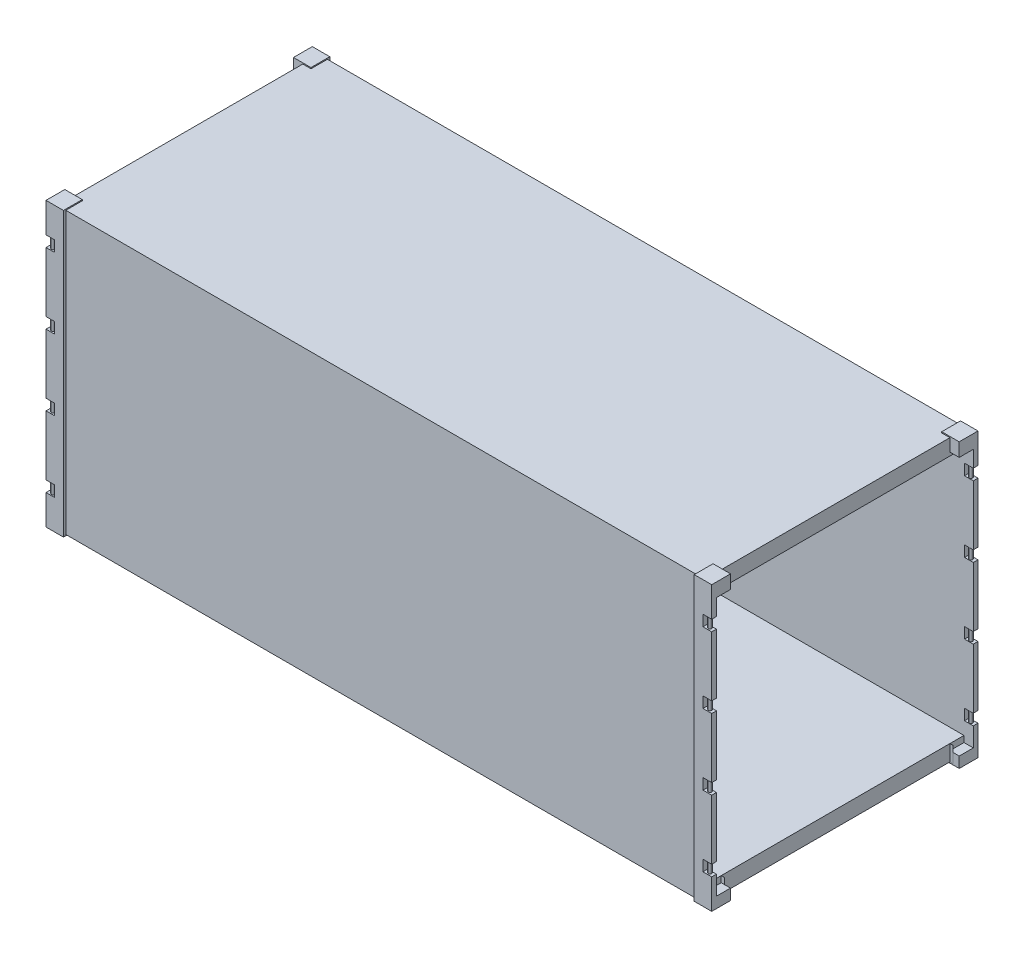
from build123d import *

# Parameters (mm, degrees)
SKETCH1_W             = 3048
SKETCH1_H             = 2581
BOSS_EXTRUDE1_DEPTH   = 1219.2
SKETCH2_W             = 2887.98
SKETCH2_H             = 21.59
CUT_EXTRUDE1_DEPTH    = 4680.285094969
SKETCH3_W             = 160
SKETCH3_H             = 172
BOSS_EXTRUDE2_DEPTH   = 10
CUT_EXTRUDE3_REACH    = 4602.631
SKETCH11_W            = 57.15
SKETCH11_H            = 1047.2
SKETCH18_W            = 3048
SKETCH18_H            = 1176.02
CUT_EXTRUDE10_DEPTH   = 2387.6
SKETCH20_W            = 85.09
SKETCH20_H            = 2094
CUT_EXTRUDE12_DEPTH   = 4685.808320519
SKETCH16_W            = 85.09
SKETCH16_H            = 128.82
CUT_EXTRUDE8_DEPTH    = 56.5
CUT_EXTRUDE19_REACH   = 4184.109
SKETCH29_W            = 80
SKETCH29_H            = 100
SKETCH36_W            = 2861.31
SKETCH36_H            = 1096.01
CUT_EXTRUDE25_DEPTH   = 132.79882
SKETCH44_W            = 15
SKETCH44_H            = 100
CUT_EXTRUDE26_DEPTH   = 10
LPATTERN1_COUNT       = 4
LPATTERN1_PITCH       = 647.75
SKETCH54_W            = 85.09
SKETCH54_H            = 129.02
BOSS_EXTRUDE4_DEPTH   = 76.2
SKETCH53_W            = 152.4
SKETCH53_H            = 107.696
BOSS_EXTRUDE3_DEPTH   = 1176.02
MIRROR2_START         = 10
MIRROR2_OUTLINE_R     = 15
MIRROR2_DEPTH         = 2571
MIRROR2_START_2       = 2543.1
MIRROR2_2_OUTLINE_R   = 15
MIRROR2_2_DEPTH       = 37.9
MIRROR2_3_OUTLINE_W   = 80
MIRROR2_3_OUTLINE_H   = 43.18
MIRROR2_3_OUTLINE_R   = 15
MIRROR2_3_DEPTH       = 145.5
MIRROR2_START_3       = 142.79882
MIRROR2_4_OUTLINE_W   = 2861.31
MIRROR2_4_OUTLINE_H   = 1096.01
MIRROR2_4_DEPTH       = 12.70118
MIRROR2_START_4       = 2435.404
MIRROR2_5_OUTLINE_W   = 80
MIRROR2_5_OUTLINE_H   = 43.18
MIRROR2_5_OUTLINE_R   = 15
MIRROR2_5_OUTLINE_W_2 = 152.4
MIRROR2_5_OUTLINE_H_2 = 1176.02
MIRROR2_5_DEPTH       = 107.696
MIRROR2_START_5       = 373.875
MIRROR2_6_OUTLINE_W   = 80
MIRROR2_6_OUTLINE_H   = 43.18
MIRROR2_6_OUTLINE_R   = 15
MIRROR2_6_DEPTH       = 547.75
MIRROR2_START_6       = 1021.625
MIRROR2_7_OUTLINE_W   = 80
MIRROR2_7_OUTLINE_H   = 43.18
MIRROR2_7_OUTLINE_R   = 15
MIRROR2_7_DEPTH       = 547.75
MIRROR2_START_7       = 1669.375
MIRROR2_8_OUTLINE_W   = 80
MIRROR2_8_OUTLINE_H   = 43.18
MIRROR2_8_OUTLINE_R   = 15
MIRROR2_8_DEPTH       = 547.75
MIRROR2_9_OUTLINE_W   = 160
MIRROR2_9_OUTLINE_H   = 172
MIRROR2_9_DEPTH       = 99
MIRROR2_START_8       = 2466.9
MIRROR2_10_OUTLINE_W  = 160.02
MIRROR2_10_OUTLINE_H  = 172.2
MIRROR2_10_DEPTH      = 124.1
MIRROR2_START_9       = 155.5
MIRROR2_11_OUTLINE_W  = 80
MIRROR2_11_OUTLINE_H  = 43.18
MIRROR2_11_OUTLINE_R  = 15
MIRROR2_11_DEPTH      = 118.375
MIRROR2_START_10      = 2317.125
MIRROR2_12_OUTLINE_W  = 80
MIRROR2_12_OUTLINE_H  = 43.18
MIRROR2_12_OUTLINE_R  = 15
MIRROR2_12_DEPTH      = 118.279
MIRROR1_START         = 10
MIRROR1_OUTLINE_R     = 15
MIRROR1_DEPTH         = 2571
MIRROR1_START_2       = 2543.1
MIRROR1_2_OUTLINE_R   = 15
MIRROR1_2_DEPTH       = 37.9
MIRROR1_3_OUTLINE_W   = 80
MIRROR1_3_OUTLINE_H   = 43.18
MIRROR1_3_OUTLINE_R   = 15
MIRROR1_3_DEPTH       = 145.5
MIRROR1_START_3       = 142.79882
MIRROR1_4_OUTLINE_W   = 2861.31
MIRROR1_4_OUTLINE_H   = 2192.02
MIRROR1_4_DEPTH       = 12.70118
MIRROR1_START_4       = 2435.404
MIRROR1_5_OUTLINE_W   = 152.4
MIRROR1_5_OUTLINE_H   = 2352.04
MIRROR1_5_OUTLINE_W_2 = 80
MIRROR1_5_OUTLINE_H_2 = 43.18
MIRROR1_5_OUTLINE_R   = 15
MIRROR1_5_DEPTH       = 107.696
MIRROR1_START_5       = 373.875
MIRROR1_6_OUTLINE_W   = 80
MIRROR1_6_OUTLINE_H   = 43.18
MIRROR1_6_OUTLINE_R   = 15
MIRROR1_6_DEPTH       = 547.75
MIRROR1_START_6       = 1021.625
MIRROR1_7_OUTLINE_W   = 80
MIRROR1_7_OUTLINE_H   = 43.18
MIRROR1_7_OUTLINE_R   = 15
MIRROR1_7_DEPTH       = 547.75
MIRROR1_START_7       = 1669.375
MIRROR1_8_OUTLINE_W   = 80
MIRROR1_8_OUTLINE_H   = 43.18
MIRROR1_8_OUTLINE_R   = 15
MIRROR1_8_DEPTH       = 547.75
MIRROR1_9_OUTLINE_W   = 160
MIRROR1_9_OUTLINE_H   = 172
MIRROR1_9_DEPTH       = 99
MIRROR1_START_8       = 2466.9
MIRROR1_10_OUTLINE_W  = 160.02
MIRROR1_10_OUTLINE_H  = 172.2
MIRROR1_10_DEPTH      = 124.1
MIRROR1_START_9       = 155.5
MIRROR1_11_OUTLINE_W  = 80
MIRROR1_11_OUTLINE_H  = 43.18
MIRROR1_11_OUTLINE_R  = 15
MIRROR1_11_DEPTH      = 118.375
MIRROR1_START_10      = 2317.125
MIRROR1_12_OUTLINE_W  = 80
MIRROR1_12_OUTLINE_H  = 43.18
MIRROR1_12_OUTLINE_R  = 15
MIRROR1_12_DEPTH      = 118.279


# Read off the part's stored shape, not the designer's step: Mirror2, Mirror1
with BuildPart() as part:
    # Sketch1 → Boss-Extrude1 (new body)
    with BuildSketch(Plane.XY.offset(2438)):
        with Locations((1524, 1300.5)):
            Rectangle(SKETCH1_W, SKETCH1_H)
    extrude(amount=-BOSS_EXTRUDE1_DEPTH)

    # Sketch2 → Cut-Extrude1 (cut, through all)
    with BuildSketch(Plane(origin=(0, 2591, 0), x_dir=(-1, 0, 0), z_dir=(0, 1, 0))):
        with Locations((-1604.01, 2427.205)):
            Rectangle(SKETCH2_W, SKETCH2_H)
    extrude(amount=-CUT_EXTRUDE1_DEPTH, mode=Mode.SUBTRACT)

    # Sketch3 → Boss-Extrude2 (add)
    with BuildSketch(Plane.XZ.offset(-10)):
        with Locations((80, 2352)):
            Rectangle(SKETCH3_W, SKETCH3_H)
    extrude(amount=BOSS_EXTRUDE2_DEPTH)

    # Sketch11 → Cut-Extrude3 (cut, up to next)
    with BuildSketch(Plane(origin=(0, 2435.5, 0), x_dir=(-1, 0, 0), z_dir=(0, 1, 0)), mode=Mode.PRIVATE) as cut_extrude3_sk1:
        with Locations((-28.575, 1742.4)):
            Rectangle(SKETCH11_W, SKETCH11_H)
    cut_extrude3_tool1 = extrude(cut_extrude3_sk1.sketch, amount=-CUT_EXTRUDE3_REACH, mode=Mode.PRIVATE) & part.part
    add(cut_extrude3_tool1.solids().sort_by_distance((28.575, 2435.5, 1742.4))[0], mode=Mode.SUBTRACT)

    # Sketch18 → Cut-Extrude10 (cut)
    with BuildSketch(Plane.XZ.offset(-155.5)):
        with Locations((1524, 1806.81)):
            Rectangle(SKETCH18_W, SKETCH18_H)
    extrude(amount=-CUT_EXTRUDE10_DEPTH, mode=Mode.SUBTRACT)

    # Sketch20 → Cut-Extrude12 (cut, through all)
    with BuildSketch(Plane(origin=(0, 2591, 0), x_dir=(-1, 0, 0), z_dir=(0, 1, 0))):
        with Locations((-42.545, 1218.8)):
            Rectangle(SKETCH20_W, SKETCH20_H)
    extrude(amount=-CUT_EXTRUDE12_DEPTH, mode=Mode.SUBTRACT)

    # Sketch16 → Cut-Extrude8 (cut)
    with BuildSketch(Plane(origin=(0, 155.5, 0), x_dir=(-1, 0, 0), z_dir=(0, 1, 0))):
        with Locations((-42.545, 2330.41)):
            Rectangle(SKETCH16_W, SKETCH16_H)
    extrude(amount=-CUT_EXTRUDE8_DEPTH, mode=Mode.SUBTRACT)

    # Sketch29 → Cut-Extrude19 (cut, up to next)
    with BuildSketch(Plane.XY.offset(2438), mode=Mode.PRIVATE) as cut_extrude19_sk1:
        with Locations((40, 2267.125)):
            Rectangle(SKETCH29_W, SKETCH29_H)
    cut_extrude19_tool1 = extrude(cut_extrude19_sk1.sketch, amount=-CUT_EXTRUDE19_REACH, mode=Mode.PRIVATE) & part.part
    cut_extrude19 = cut_extrude19_tool1.solids().sort_by_distance((40, 2267.125, 2438))[0]
    add(cut_extrude19, mode=Mode.SUBTRACT)

    # Sketch36 → Cut-Extrude25 (cut)
    with BuildSketch(Plane.XZ.offset(-10)):
        with Locations((1617.345, 1766.805)):
            Rectangle(SKETCH36_W, SKETCH36_H)
    extrude(amount=-CUT_EXTRUDE25_DEPTH, mode=Mode.SUBTRACT)

    # Sketch44 → Revolve8 (revolve)
    with BuildSketch(Plane(origin=(0, 0, 2413.5), x_dir=(-1, 0, 0), z_dir=(0, 0, -1)), mode=Mode.PRIVATE) as revolve8_sk:
        with Locations((-47.5, 2267.125)):
            Rectangle(SKETCH44_W, SKETCH44_H)
    revolve8 = revolve(revolve8_sk.sketch.rotate(Axis((40, 2217.125, 2413.5), (0, 1, 0)), 270), axis=Axis((40, 2217.125, 2413.5), (0, 1, 0)))

    # Sketch45 → Cut-Extrude26 (cut)
    with BuildSketch(Plane(origin=(0, 2591, 0), x_dir=(-1, 0, 0), z_dir=(0, 1, 0))):
        Polygon((-3048, 1218.8), (-3048, 2416.41), (-160.02, 2416.41), (-160.02, 2265.8), (-85.09, 2265.8), (-85.09, 1218.8), align=None)
    extrude(amount=-CUT_EXTRUDE26_DEPTH, mode=Mode.SUBTRACT)

    # LPattern1: Cut-Extrude19, Revolve8 ×4
    with Locations(*[(0, -i * LPATTERN1_PITCH, 0) for i in range(1, LPATTERN1_COUNT)]):
        add(cut_extrude19, mode=Mode.SUBTRACT)
        add(revolve8)

    # Sketch54 → Boss-Extrude4 (add)
    with BuildSketch(Plane.XZ.offset(-2543.1)):
        with Locations((42.545, 2330.31)):
            Rectangle(SKETCH54_W, SKETCH54_H)
    extrude(amount=BOSS_EXTRUDE4_DEPTH)

    # Sketch53 → Boss-Extrude3 (add)
    with BuildSketch(Plane(origin=(0, 0, 2394.82), x_dir=(-1, 0, 0), z_dir=(0, 0, -1))):
        with Locations((-161.29, 2489.252)):
            Rectangle(SKETCH53_W, SKETCH53_H)
    extrude(amount=BOSS_EXTRUDE3_DEPTH)



with BuildPart() as body_2:
    # Mirror2 outline → Mirror2 (new body)
    with BuildSketch(Plane(origin=(0, 0, 0), x_dir=(1, 0, 0), z_dir=(0, 1, 0)).offset(MIRROR2_START)):
        Polygon((80, 0.4), (80, -42.78), (3048, -42.78), (3048, -21.19), (160.02, -21.19), (160.02, 0.4), align=None)
        with Locations((40, -24.1)):
            Circle(MIRROR2_OUTLINE_R)
    extrude(amount=MIRROR2_DEPTH)


with BuildPart() as part_1:
    add(part.part)

    add(body_2.part)  # Mirror2 2 merges body 2
    # Mirror2 2 outline → Mirror2 2 (add)
    with BuildSketch(Plane(origin=(0, 0, 0), x_dir=(1, 0, 0), z_dir=(0, 1, 0)).offset(MIRROR2_START_2)):
        Polygon((0, -171.8), (85.09, -171.8), (85.09, -1218.8), (3048, -1218.8), (3048, -42.78), (80, -42.78), (80, 0.4), (0, 0.4), align=None)
        with Locations((40, -24.1)):
            Circle(MIRROR2_2_OUTLINE_R, mode=Mode.SUBTRACT)
    extrude(amount=MIRROR2_2_DEPTH)

    # Mirror2 3 outline → Mirror2 3 (add)
    # profile 1 of 2: a face of its own
    with BuildSketch(Plane(origin=(0, 0, 0), x_dir=(1, 0, 0), z_dir=(0, 1, 0)).offset(MIRROR2_START)):
        with Locations((40, -21.19)):
            Rectangle(MIRROR2_3_OUTLINE_W, MIRROR2_3_OUTLINE_H)
        with Locations((40, -24.1)):
            Circle(MIRROR2_3_OUTLINE_R, mode=Mode.SUBTRACT)
    # profile 2 of 2: a face of its own
    with BuildSketch(Plane(origin=(0, 0, 0), x_dir=(1, 0, 0), z_dir=(0, 1, 0)).offset(MIRROR2_START)):
        Polygon((85.09, -171.6), (57.15, -171.6), (57.15, -171.8), (85.09, -171.8), (85.09, -1218.8), (186.69, -1218.8), (186.69, -122.79), (3048, -122.79), (3048, -42.78), (85.09, -42.78), align=None)
    extrude(amount=MIRROR2_3_DEPTH)

    # Mirror2 4 outline → Mirror2 4 (add)
    with BuildSketch(Plane(origin=(0, 0, 0), x_dir=(1, 0, 0), z_dir=(0, 1, 0)).offset(MIRROR2_START_3)):
        with Locations((1617.345, -670.795)):
            Rectangle(MIRROR2_4_OUTLINE_W, MIRROR2_4_OUTLINE_H)
    extrude(amount=MIRROR2_4_DEPTH)

    # Mirror2 5 outline → Mirror2 5 (add)
    # profile 1 of 2: a face of its own
    with BuildSketch(Plane(origin=(0, 0, 0), x_dir=(1, 0, 0), z_dir=(0, 1, 0)).offset(MIRROR2_START_4)):
        with Locations((40, -21.19)):
            Rectangle(MIRROR2_5_OUTLINE_W, MIRROR2_5_OUTLINE_H)
        with Locations((40, -24.1)):
            Circle(MIRROR2_5_OUTLINE_R, mode=Mode.SUBTRACT)
    # profile 2 of 2: a face of its own
    with BuildSketch(Plane(origin=(0, 0, 0), x_dir=(1, 0, 0), z_dir=(0, 1, 0)).offset(MIRROR2_START_4)):
        with Locations((161.29, -630.79)):
            Rectangle(MIRROR2_5_OUTLINE_W_2, MIRROR2_5_OUTLINE_H_2)
    extrude(amount=MIRROR2_5_DEPTH)

    # Mirror2 6 outline → Mirror2 6 (add)
    with BuildSketch(Plane(origin=(0, 0, 0), x_dir=(1, 0, 0), z_dir=(0, 1, 0)).offset(MIRROR2_START_5)):
        with Locations((40, -21.19)):
            Rectangle(MIRROR2_6_OUTLINE_W, MIRROR2_6_OUTLINE_H)
        with Locations((40, -24.1)):
            Circle(MIRROR2_6_OUTLINE_R, mode=Mode.SUBTRACT)
    extrude(amount=MIRROR2_6_DEPTH)

    # Mirror2 7 outline → Mirror2 7 (add)
    with BuildSketch(Plane(origin=(0, 0, 0), x_dir=(1, 0, 0), z_dir=(0, 1, 0)).offset(MIRROR2_START_6)):
        with Locations((40, -21.19)):
            Rectangle(MIRROR2_7_OUTLINE_W, MIRROR2_7_OUTLINE_H)
        with Locations((40, -24.1)):
            Circle(MIRROR2_7_OUTLINE_R, mode=Mode.SUBTRACT)
    extrude(amount=MIRROR2_7_DEPTH)

    # Mirror2 8 outline → Mirror2 8 (add)
    with BuildSketch(Plane(origin=(0, 0, 0), x_dir=(1, 0, 0), z_dir=(0, 1, 0)).offset(MIRROR2_START_7)):
        with Locations((40, -21.19)):
            Rectangle(MIRROR2_8_OUTLINE_W, MIRROR2_8_OUTLINE_H)
        with Locations((40, -24.1)):
            Circle(MIRROR2_8_OUTLINE_R, mode=Mode.SUBTRACT)
    extrude(amount=MIRROR2_8_DEPTH)

    # Mirror2 9 outline → Mirror2 9 (add)
    with BuildSketch(Plane(origin=(0, 0, 0), x_dir=(1, 0, 0), z_dir=(0, 1, 0))):
        with Locations((80, -85.6)):
            Rectangle(MIRROR2_9_OUTLINE_W, MIRROR2_9_OUTLINE_H)
    extrude(amount=MIRROR2_9_DEPTH)

    # Mirror2 10 outline → Mirror2 10 (add)
    with BuildSketch(Plane(origin=(0, 0, 0), x_dir=(1, 0, 0), z_dir=(0, 1, 0)).offset(MIRROR2_START_8)):
        with Locations((80.01, -85.7)):
            Rectangle(MIRROR2_10_OUTLINE_W, MIRROR2_10_OUTLINE_H)
    extrude(amount=MIRROR2_10_DEPTH)

    # Mirror2 11 outline → Mirror2 11 (add)
    with BuildSketch(Plane(origin=(0, 0, 0), x_dir=(1, 0, 0), z_dir=(0, 1, 0)).offset(MIRROR2_START_9)):
        with Locations((40, -21.19)):
            Rectangle(MIRROR2_11_OUTLINE_W, MIRROR2_11_OUTLINE_H)
        with Locations((40, -24.1)):
            Circle(MIRROR2_11_OUTLINE_R, mode=Mode.SUBTRACT)
    extrude(amount=MIRROR2_11_DEPTH)

    # Mirror2 12 outline → Mirror2 12 (add)
    with BuildSketch(Plane(origin=(0, 0, 0), x_dir=(1, 0, 0), z_dir=(0, 1, 0)).offset(MIRROR2_START_10)):
        with Locations((40, -21.19)):
            Rectangle(MIRROR2_12_OUTLINE_W, MIRROR2_12_OUTLINE_H)
        with Locations((40, -24.1)):
            Circle(MIRROR2_12_OUTLINE_R, mode=Mode.SUBTRACT)
    extrude(amount=MIRROR2_12_DEPTH)

    # Mirror1 outline → Mirror1 (add)
    with BuildSketch(Plane(origin=(0, 0, 0), x_dir=(1, 0, 0), z_dir=(0, 1, 0)).offset(MIRROR1_START)):
        Polygon((6016, -42.78), (6016, 0.4), (5935.98, 0.4), (5935.98, -21.19), (3048, -21.19), (3048, -42.78), align=None)
        Polygon((3048, -2416.41), (5935.98, -2416.41), (5935.98, -2438), (6016, -2438), (6016, -2394.82), (3048, -2394.82), align=None)
        with Locations((6056, -2413.5)):
            Circle(MIRROR1_OUTLINE_R)
        with Locations((6056, -24.1)):
            Circle(MIRROR1_OUTLINE_R)
    extrude(amount=MIRROR1_DEPTH)

    # Mirror1 2 outline → Mirror1 2 (add)
    with BuildSketch(Plane(origin=(0, 0, 0), x_dir=(1, 0, 0), z_dir=(0, 1, 0)).offset(MIRROR1_START_2)):
        Polygon((3048, -42.78), (3048, -2394.82), (6016, -2394.82), (6016, -2438), (6096, -2438), (6096, -2265.8), (6010.91, -2265.8), (6010.91, -171.8), (6096, -171.8), (6096, 0.4), (6016, 0.4), (6016, -42.78), align=None)
        with Locations((6056, -24.1)):
            Circle(MIRROR1_2_OUTLINE_R, mode=Mode.SUBTRACT)
        with Locations((6056, -2413.5)):
            Circle(MIRROR1_2_OUTLINE_R, mode=Mode.SUBTRACT)
    extrude(amount=MIRROR1_2_DEPTH)

    # Mirror1 3 outline → Mirror1 3 (add)
    # profile 1 of 3: a face of its own
    with BuildSketch(Plane(origin=(0, 0, 0), x_dir=(1, 0, 0), z_dir=(0, 1, 0)).offset(MIRROR1_START)):
        Polygon((6010.91, -171.6), (6010.91, -42.78), (3048, -42.78), (3048, -122.79), (5909.31, -122.79), (5909.31, -2314.81), (3048, -2314.81), (3048, -2394.82), (6010.91, -2394.82), (6010.91, -2266), (6038.85, -2266), (6038.85, -2265.8), (6010.91, -2265.8), (6010.91, -171.8), (6038.85, -171.8), (6038.85, -171.6), align=None)
    # profile 2 of 3: a face of its own
    with BuildSketch(Plane(origin=(0, 0, 0), x_dir=(1, 0, 0), z_dir=(0, 1, 0)).offset(MIRROR1_START)):
        with Locations((6056, -21.19)):
            Rectangle(MIRROR1_3_OUTLINE_W, MIRROR1_3_OUTLINE_H)
        with Locations((6056, -24.1)):
            Circle(MIRROR1_3_OUTLINE_R, mode=Mode.SUBTRACT)
    # profile 3 of 3: a face of its own
    with BuildSketch(Plane(origin=(0, 0, 0), x_dir=(1, 0, 0), z_dir=(0, 1, 0)).offset(MIRROR1_START)):
        with Locations((6056, -2416.41)):
            Rectangle(MIRROR1_3_OUTLINE_W, MIRROR1_3_OUTLINE_H)
        with Locations((6056, -2413.5)):
            Circle(MIRROR1_3_OUTLINE_R, mode=Mode.SUBTRACT)
    extrude(amount=MIRROR1_3_DEPTH)

    # Mirror1 4 outline → Mirror1 4 (add)
    with BuildSketch(Plane(origin=(0, 0, 0), x_dir=(1, 0, 0), z_dir=(0, 1, 0)).offset(MIRROR1_START_3)):
        with Locations((4478.655, -1218.8)):
            Rectangle(MIRROR1_4_OUTLINE_W, MIRROR1_4_OUTLINE_H)
    extrude(amount=MIRROR1_4_DEPTH)

    # Mirror1 5 outline → Mirror1 5 (add)
    # profile 1 of 3: a face of its own
    with BuildSketch(Plane(origin=(0, 0, 0), x_dir=(1, 0, 0), z_dir=(0, 1, 0)).offset(MIRROR1_START_4)):
        with Locations((5934.71, -1218.8)):
            Rectangle(MIRROR1_5_OUTLINE_W, MIRROR1_5_OUTLINE_H)
    # profile 2 of 3: a face of its own
    with BuildSketch(Plane(origin=(0, 0, 0), x_dir=(1, 0, 0), z_dir=(0, 1, 0)).offset(MIRROR1_START_4)):
        with Locations((6056, -21.19)):
            Rectangle(MIRROR1_5_OUTLINE_W_2, MIRROR1_5_OUTLINE_H_2)
        with Locations((6056, -24.1)):
            Circle(MIRROR1_5_OUTLINE_R, mode=Mode.SUBTRACT)
    # profile 3 of 3: a face of its own
    with BuildSketch(Plane(origin=(0, 0, 0), x_dir=(1, 0, 0), z_dir=(0, 1, 0)).offset(MIRROR1_START_4)):
        with Locations((6056, -2416.41)):
            Rectangle(MIRROR1_5_OUTLINE_W_2, MIRROR1_5_OUTLINE_H_2)
        with Locations((6056, -2413.5)):
            Circle(MIRROR1_5_OUTLINE_R, mode=Mode.SUBTRACT)
    extrude(amount=MIRROR1_5_DEPTH)

    # Mirror1 6 outline → Mirror1 6 (add)
    # profile 1 of 2: a face of its own
    with BuildSketch(Plane(origin=(0, 0, 0), x_dir=(1, 0, 0), z_dir=(0, 1, 0)).offset(MIRROR1_START_5)):
        with Locations((6056, -21.19)):
            Rectangle(MIRROR1_6_OUTLINE_W, MIRROR1_6_OUTLINE_H)
        with Locations((6056, -24.1)):
            Circle(MIRROR1_6_OUTLINE_R, mode=Mode.SUBTRACT)
    # profile 2 of 2: a face of its own
    with BuildSketch(Plane(origin=(0, 0, 0), x_dir=(1, 0, 0), z_dir=(0, 1, 0)).offset(MIRROR1_START_5)):
        with Locations((6056, -2416.41)):
            Rectangle(MIRROR1_6_OUTLINE_W, MIRROR1_6_OUTLINE_H)
        with Locations((6056, -2413.5)):
            Circle(MIRROR1_6_OUTLINE_R, mode=Mode.SUBTRACT)
    extrude(amount=MIRROR1_6_DEPTH)

    # Mirror1 7 outline → Mirror1 7 (add)
    # profile 1 of 2: a face of its own
    with BuildSketch(Plane(origin=(0, 0, 0), x_dir=(1, 0, 0), z_dir=(0, 1, 0)).offset(MIRROR1_START_6)):
        with Locations((6056, -21.19)):
            Rectangle(MIRROR1_7_OUTLINE_W, MIRROR1_7_OUTLINE_H)
        with Locations((6056, -24.1)):
            Circle(MIRROR1_7_OUTLINE_R, mode=Mode.SUBTRACT)
    # profile 2 of 2: a face of its own
    with BuildSketch(Plane(origin=(0, 0, 0), x_dir=(1, 0, 0), z_dir=(0, 1, 0)).offset(MIRROR1_START_6)):
        with Locations((6056, -2416.41)):
            Rectangle(MIRROR1_7_OUTLINE_W, MIRROR1_7_OUTLINE_H)
        with Locations((6056, -2413.5)):
            Circle(MIRROR1_7_OUTLINE_R, mode=Mode.SUBTRACT)
    extrude(amount=MIRROR1_7_DEPTH)

    # Mirror1 8 outline → Mirror1 8 (add)
    # profile 1 of 2: a face of its own
    with BuildSketch(Plane(origin=(0, 0, 0), x_dir=(1, 0, 0), z_dir=(0, 1, 0)).offset(MIRROR1_START_7)):
        with Locations((6056, -21.19)):
            Rectangle(MIRROR1_8_OUTLINE_W, MIRROR1_8_OUTLINE_H)
        with Locations((6056, -24.1)):
            Circle(MIRROR1_8_OUTLINE_R, mode=Mode.SUBTRACT)
    # profile 2 of 2: a face of its own
    with BuildSketch(Plane(origin=(0, 0, 0), x_dir=(1, 0, 0), z_dir=(0, 1, 0)).offset(MIRROR1_START_7)):
        with Locations((6056, -2416.41)):
            Rectangle(MIRROR1_8_OUTLINE_W, MIRROR1_8_OUTLINE_H)
        with Locations((6056, -2413.5)):
            Circle(MIRROR1_8_OUTLINE_R, mode=Mode.SUBTRACT)
    extrude(amount=MIRROR1_8_DEPTH)

    # Mirror1 9 outline → Mirror1 9 (add)
    with BuildSketch(Plane(origin=(0, 0, 0), x_dir=(1, 0, 0), z_dir=(0, 1, 0))):
        with Locations((6016, -85.6)):
            Rectangle(MIRROR1_9_OUTLINE_W, MIRROR1_9_OUTLINE_H)
        with Locations((6016, -2352)):
            Rectangle(MIRROR1_9_OUTLINE_W, MIRROR1_9_OUTLINE_H)
    extrude(amount=MIRROR1_9_DEPTH)

    # Mirror1 10 outline → Mirror1 10 (add)
    with BuildSketch(Plane(origin=(0, 0, 0), x_dir=(1, 0, 0), z_dir=(0, 1, 0)).offset(MIRROR1_START_8)):
        with Locations((6015.99, -85.7)):
            Rectangle(MIRROR1_10_OUTLINE_W, MIRROR1_10_OUTLINE_H)
        with Locations((6015.99, -2351.9)):
            Rectangle(MIRROR1_10_OUTLINE_W, MIRROR1_10_OUTLINE_H)
    extrude(amount=MIRROR1_10_DEPTH)

    # Mirror1 11 outline → Mirror1 11 (add)
    # profile 1 of 2: a face of its own
    with BuildSketch(Plane(origin=(0, 0, 0), x_dir=(1, 0, 0), z_dir=(0, 1, 0)).offset(MIRROR1_START_9)):
        with Locations((6056, -21.19)):
            Rectangle(MIRROR1_11_OUTLINE_W, MIRROR1_11_OUTLINE_H)
        with Locations((6056, -24.1)):
            Circle(MIRROR1_11_OUTLINE_R, mode=Mode.SUBTRACT)
    # profile 2 of 2: a face of its own
    with BuildSketch(Plane(origin=(0, 0, 0), x_dir=(1, 0, 0), z_dir=(0, 1, 0)).offset(MIRROR1_START_9)):
        with Locations((6056, -2416.41)):
            Rectangle(MIRROR1_11_OUTLINE_W, MIRROR1_11_OUTLINE_H)
        with Locations((6056, -2413.5)):
            Circle(MIRROR1_11_OUTLINE_R, mode=Mode.SUBTRACT)
    extrude(amount=MIRROR1_11_DEPTH)

    # Mirror1 12 outline → Mirror1 12 (add)
    # profile 1 of 2: a face of its own
    with BuildSketch(Plane(origin=(0, 0, 0), x_dir=(1, 0, 0), z_dir=(0, 1, 0)).offset(MIRROR1_START_10)):
        with Locations((6056, -21.19)):
            Rectangle(MIRROR1_12_OUTLINE_W, MIRROR1_12_OUTLINE_H)
        with Locations((6056, -24.1)):
            Circle(MIRROR1_12_OUTLINE_R, mode=Mode.SUBTRACT)
    # profile 2 of 2: a face of its own
    with BuildSketch(Plane(origin=(0, 0, 0), x_dir=(1, 0, 0), z_dir=(0, 1, 0)).offset(MIRROR1_START_10)):
        with Locations((6056, -2416.41)):
            Rectangle(MIRROR1_12_OUTLINE_W, MIRROR1_12_OUTLINE_H)
        with Locations((6056, -2413.5)):
            Circle(MIRROR1_12_OUTLINE_R, mode=Mode.SUBTRACT)
    extrude(amount=MIRROR1_12_DEPTH)


solid = part_1.part
